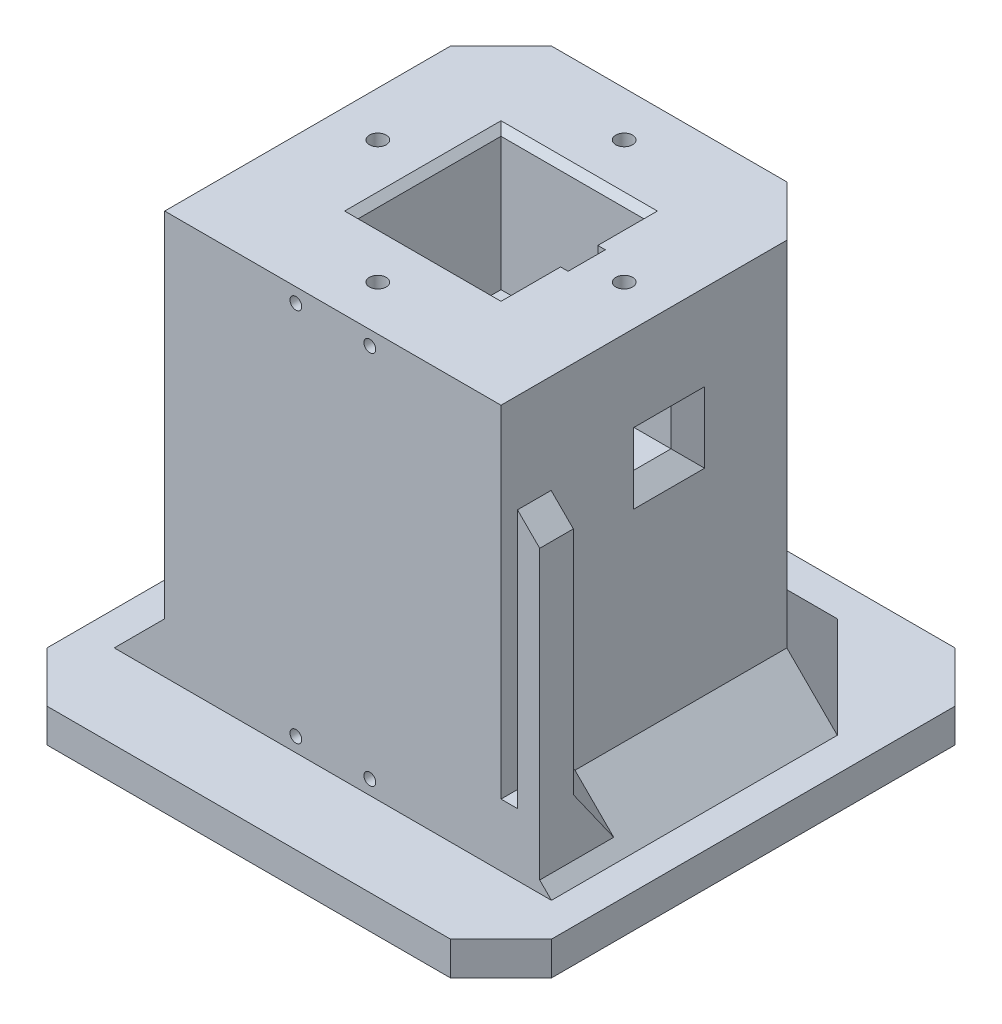
from build123d import *

# Parameters (mm, degrees)
SKETCH1_W           = 150
SKETCH1_H           = 150
BOSS_EXTRUDE1_DEPTH = 10
SKETCH2_W           = 100
SKETCH2_H           = 100
BOSS_EXTRUDE2_DEPTH = 120
SKETCH3_W           = 42.5
SKETCH3_H           = 42.5
CUT_EXTRUDE1_DEPTH  = 41.5
CHAMFER1_SIZE       = 15
CHAMFER2_SIZE       = 15
SKETCH4_W           = 4.242368117
SKETCH4_H           = 5.545736957
CUT_EXTRUDE2_DEPTH  = 41.5
SKETCH5_W           = 11.091473914
SKETCH5_H           = 11.017090126
CUT_EXTRUDE5_DEPTH  = 24.507631883
CHAMFER3_SIZE       = 5
CHAMFER4_SIZE       = 5
CHAMFER5_SIZE       = 2
SKETCH6_R           = 1.75
CUT_EXTRUDE6_DEPTH  = 10
BOSS_EXTRUDE3_DEPTH = 10
CHAMFER6_SIZE       = 12
SKETCH8_R           = 2.5
CUT_EXTRUDE7_DEPTH  = 10


with BuildPart() as part:
    # Sketch1 → Boss-Extrude1 (new body)
    with BuildSketch(Plane(origin=(0, 0, 0), x_dir=(1, 0, 0), z_dir=(0, 1, 0))):
        Rectangle(SKETCH1_W, SKETCH1_H)
    extrude(amount=BOSS_EXTRUDE1_DEPTH)

    # Sketch2 → Boss-Extrude2 (add)
    with BuildSketch(Plane(origin=(0, 10, 0), x_dir=(1, 0, 0), z_dir=(0, 1, 0))):
        Rectangle(SKETCH2_W, SKETCH2_H)
    extrude(amount=BOSS_EXTRUDE2_DEPTH)

    # Sketch3 → Cut-Extrude1 (cut)
    with BuildSketch(Plane(origin=(0, 130, 0), x_dir=(1, 0, 0), z_dir=(0, 1, 0))):
        Rectangle(SKETCH3_W, SKETCH3_H)
    extrude(amount=-CUT_EXTRUDE1_DEPTH, mode=Mode.SUBTRACT)

    # Chamfer1
    chamfer1_edges = [part.edges().sort_by_distance(p)[0] for p in [
        (75, 5, 75),
        (-75, 5, 75),
        (-75, 5, -75),
        (75, 5, -75),
    ]]
    chamfer(chamfer1_edges, length=CHAMFER1_SIZE)

    # Chamfer2
    chamfer2_edges = [part.edges().sort_by_distance(p)[0] for p in [
        (50, 10, 0),
        (0, 10, -50),
        (50, 70, -50),
        (-50, 10, 0),
        (-50, 70, -50),
    ]]
    chamfer(chamfer2_edges, length=CHAMFER2_SIZE)

    # Sketch4 → Cut-Extrude2 (cut)
    with BuildSketch(Plane(origin=(0, 130, 0), x_dir=(1, 0, 0), z_dir=(0, 1, 0))):
        with Locations((23.371184058, -2.772868478)):
            Rectangle(SKETCH4_W, SKETCH4_H)
        with Locations((23.371184058, 2.772868478)):
            Rectangle(SKETCH4_W, SKETCH4_H)
    extrude(amount=-CUT_EXTRUDE2_DEPTH, mode=Mode.SUBTRACT)

    # Sketch5 → Cut-Extrude5 (cut)
    with BuildSketch(Plane.ZY.offset(-25.492368117)):
        with Locations((0, 94.008545063)):
            Rectangle(SKETCH5_W, SKETCH5_H)
    extrude(amount=-CUT_EXTRUDE5_DEPTH, mode=Mode.SUBTRACT)

    # Chamfer3
    chamfer3_edges = [part.edges().sort_by_distance(p)[0] for p in [
        (50, 94.008545063, 5.545736957),
        (50, 88.5, 0),
        (50, 94.008545063, -5.545736957),
        (50, 99.517090126, 0),
    ]]
    chamfer(chamfer3_edges, length=CHAMFER3_SIZE)

    # Chamfer4
    chamfer4_edges = [part.edges().sort_by_distance(p)[0] for p in [
        (25.492368117, 99.517090126, 0),
    ]]
    chamfer(chamfer4_edges, length=CHAMFER4_SIZE)

    # Chamfer5
    chamfer5_edges = [part.edges().sort_by_distance(p)[0] for p in [
        (21.25, 130, -13.397868478),
        (21.25, 109.25, 5.545736957),
        (21.25, 109.25, -5.545736957),
        (21.25, 130, 13.397868478),
        (0, 130, -21.25),
        (-21.25, 130, 0),
        (0, 130, 21.25),
    ]]
    chamfer(chamfer5_edges, length=CHAMFER5_SIZE)

    # Sketch6 → Cut-Extrude6 (cut)
    with BuildSketch(Plane.XY.offset(50)):
        with Locations((-11, 125.75)):
            Circle(SKETCH6_R)
        with Locations((11, 125.75)):
            Circle(SKETCH6_R)
        with Locations((-11, 14.25)):
            Circle(SKETCH6_R)
        with Locations((11, 14.25)):
            Circle(SKETCH6_R)
    extrude(amount=-CUT_EXTRUDE6_DEPTH, mode=Mode.SUBTRACT)

    # Sketch7 → Boss-Extrude3 (add)
    with BuildSketch(Plane.XY.offset(50)):
        Polygon((54.909019499, 105.514740538), (54.909019499, 20.090980501), (61.512596017, 13.487403983), (61.512596017, 98.91116402), align=None)
    extrude(amount=-BOSS_EXTRUDE3_DEPTH)

    # Chamfer6
    chamfer6_edges = [part.edges().sort_by_distance(p)[0] for p in [
        (58.210807758, 16.789192242, 40),
    ]]
    chamfer(chamfer6_edges, length=CHAMFER6_SIZE)
    # the kernel refuses this chamfer: 12, 8.485281374 mm, written as the material it adds along each edge
    with BuildSketch(Plane(origin=(54.909019499, 20.090980501, 50), x_dir=(-0.7262819568766928, 0.687396915264654, 0), z_dir=(0, 0, -1))) as chamfer6_2_piece_1:
        with BuildLine():
            Line((12.344078342, 0), (5.484140903, 6.49265728))
            Line((5.484140903, 6.49265728), (5.309833233, 6.65763254))
            ThreePointArc((5.309833233, 6.65763254), (2.742070451, 3.24632864), (-0.17430767, 0.16497526))
            Line((-0.17430767, 0.16497526), (0.00659901, -0.23990926))
            ThreePointArc((0.00659901, -0.23990926), (6.173971977, -0.070267795), (12.350677353, -0.23990926))
            Line((12.350677353, -0.23990926), (12.344078342, 0))
        make_face()
    extrude(amount=10)
    with BuildSketch(Plane(origin=(54.909019499, 20.090980501, 40), x_dir=(-0.7262819568766887, 0.6873969152646581, 0), z_dir=(0, 0, -1))) as chamfer6_2_piece_2_section:
        with BuildLine():
            Line((12.344078342, 0), (5.484140903, 6.49265728))
            Line((5.484140903, 6.49265728), (5.309833233, 6.65763254))
            ThreePointArc((5.309833233, 6.65763254), (2.742070451, 3.24632864), (-0.17430767, 0.16497526))
            Line((-0.17430767, 0.16497526), (0.00659901, -0.23990926))
            ThreePointArc((0.00659901, -0.23990926), (6.173971977, -0.070267795), (12.350677353, -0.23990926))
            Line((12.350677353, -0.23990926), (12.344078342, 0))
        make_face()
    chamfer6_2_piece_2 = extrude(amount=42.860195856, mode=Mode.PRIVATE)
    chamfer6_2_piece_2 = split(chamfer6_2_piece_2, bisect_by=Plane(origin=(53.690480503, 27.337708231, 32.262573132), z_dir=(-0.5000000000000001, -0.5000000000000001, 0.7071067811865475)), keep=Keep.TOP, mode=Mode.PRIVATE)
    add(chamfer6_2_piece_2)

    # Sketch8 → Cut-Extrude7 (cut)
    with BuildSketch(Plane(origin=(0, 130, 0), x_dir=(1, 0, 0), z_dir=(0, 1, 0))):
        with Locations(Location((0, 36.625, 0), (0, 0, 270))):
            Circle(SKETCH8_R)
        with Locations(Location((36.625, 0, 0), (0, 0, 270))):
            Circle(SKETCH8_R)
        with Locations(Location((0, -36.625, 0), (0, 0, 270))):
            Circle(SKETCH8_R)
        with Locations(Location((-36.625, 0, 0), (0, 0, 270))):
            Circle(SKETCH8_R)
    extrude(amount=-CUT_EXTRUDE7_DEPTH, mode=Mode.SUBTRACT)


solid = part.part
